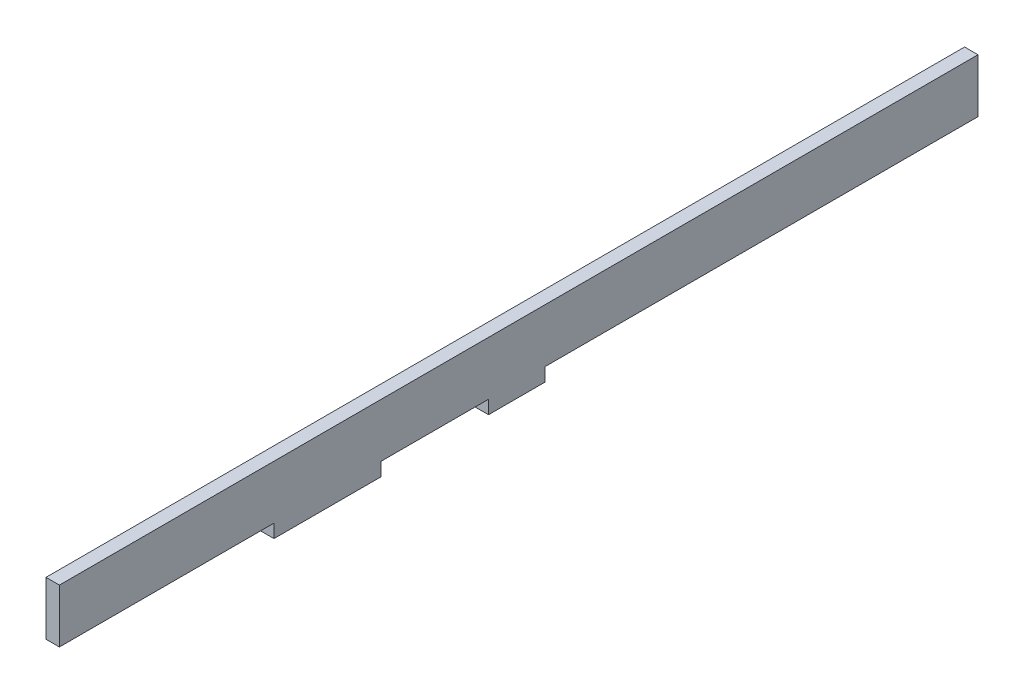
from build123d import *

# Parameters (mm, degrees)
SKETCH1_W           = 435
SKETCH1_H           = 31.75
BOSS_EXTRUDE1_DEPTH = 6.35
CUT_EXTRUDE1_REACH  = 441.326
SKETCH2_W           = 101.6
SKETCH2_H           = 6.35
CUT_EXTRUDE2_REACH  = 441.326
SKETCH3_W           = 50.8
SKETCH3_H           = 6.35


with BuildPart() as part:
    # Sketch1 → Boss-Extrude1 (new body)
    with BuildSketch(Plane(origin=(0, 0, 0), x_dir=(0, 0, -1), z_dir=(1, 0, 0))):
        with Locations((220.631015664, 15.875)):
            Rectangle(SKETCH1_W, SKETCH1_H)
    extrude(amount=BOSS_EXTRUDE1_DEPTH)

    # Sketch2 → Cut-Extrude1 (cut, up to next)
    with BuildSketch(Plane.ZY, mode=Mode.PRIVATE) as cut_extrude1_sk1:
        with Locations((-53.931015664, 3.175)):
            Rectangle(SKETCH2_W, SKETCH2_H)
    cut_extrude1_tool1 = extrude(cut_extrude1_sk1.sketch, amount=-CUT_EXTRUDE1_REACH, mode=Mode.PRIVATE) & part.part
    add(cut_extrude1_tool1.solids().sort_by_distance((0, 3.175, -53.931016))[0], mode=Mode.SUBTRACT)

    # Sketch3 → Cut-Extrude2 (cut, up to next)
    with BuildSketch(Plane.ZY, mode=Mode.PRIVATE) as cut_extrude2_sk1:
        with Locations((-180.931015664, 3.175)):
            Rectangle(SKETCH3_W, SKETCH3_H)
    cut_extrude2_tool1 = extrude(cut_extrude2_sk1.sketch, amount=-CUT_EXTRUDE2_REACH, mode=Mode.PRIVATE) & part.part
    # Sketch3 → Cut-Extrude2 (cut, up to next)
    with BuildSketch(Plane.ZY, mode=Mode.PRIVATE) as cut_extrude2_sk2:
        Polygon((-233.131015664, 6.35), (-233.131015664, 0), (-307.931015664, 0), (-438.131015664, 0), (-438.131015664, 6.35), (-307.931015664, 6.35), align=None)
    cut_extrude2_tool2 = extrude(cut_extrude2_sk2.sketch, amount=-CUT_EXTRUDE2_REACH, mode=Mode.PRIVATE) & part.part
    add(cut_extrude2_tool1.solids().sort_by_distance((0, 3.175, -180.931016))[0], mode=Mode.SUBTRACT)
    add(cut_extrude2_tool2.solids().sort_by_distance((0, 3.175, -335.631016))[0], mode=Mode.SUBTRACT)


solid = part.part
